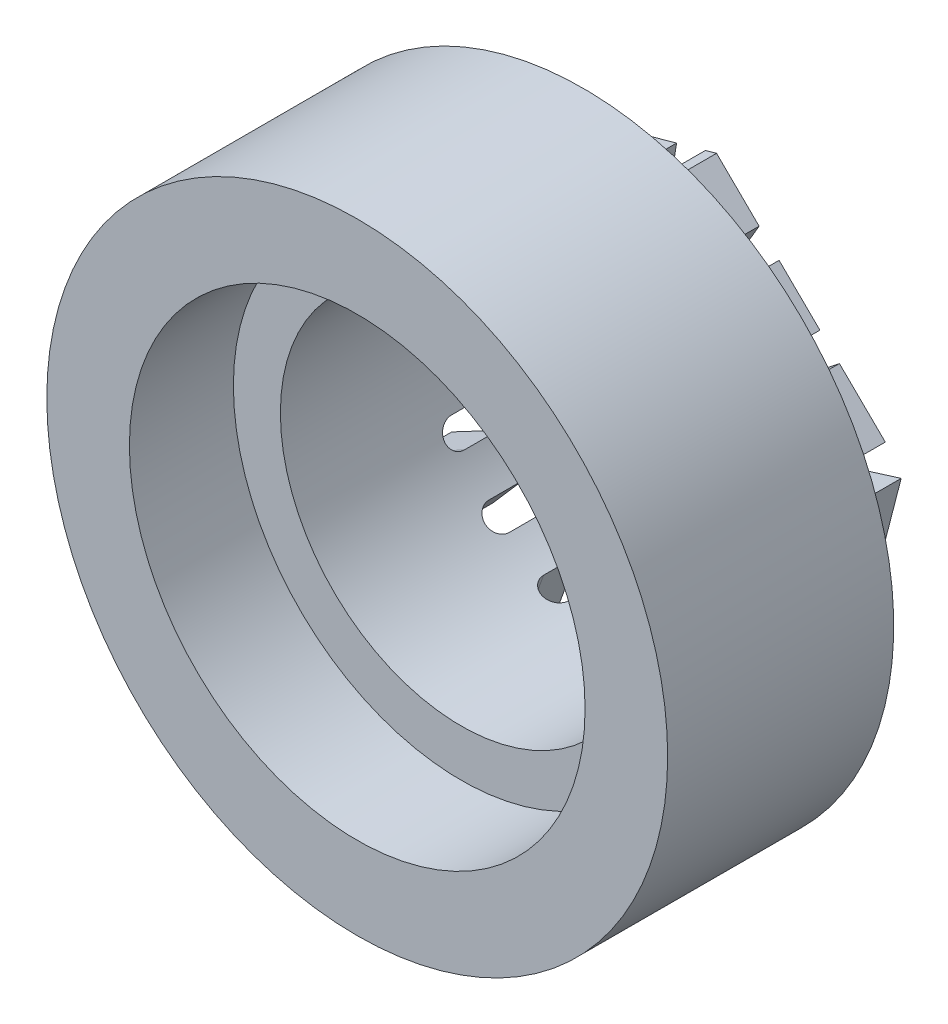
from build123d import *

# Parameters (mm, degrees)
SKETCH1_R           = 21.79955
BOSS_EXTRUDE1_DEPTH = 20.6502
SKETCH2_R           = 12.7
CUT_EXTRUDE1_DEPTH  = 20.6502
SKETCH3_R           = 16.000000004
CUT_EXTRUDE2_DEPTH  = 7.3025
SKETCH4_OUTSIDE_W   = 58.604
SKETCH4_OUTSIDE_H   = 58.604
CUT_EXTRUDE3_DEPTH  = 4.7752
CUT_EXTRUDE4_DEPTH  = 9.8552
CIRPATTERN1_COUNT   = 17


with BuildPart() as part:
    # Sketch1 → Boss-Extrude1 (new body)
    with BuildSketch(Plane.XY):
        Circle(SKETCH1_R)
    extrude(amount=BOSS_EXTRUDE1_DEPTH)

    # Sketch2 → Cut-Extrude1 (cut)
    with BuildSketch(Plane.XY.offset(20.6502)):
        Circle(SKETCH2_R)
    extrude(amount=-CUT_EXTRUDE1_DEPTH, mode=Mode.SUBTRACT)

    # Sketch3 → Cut-Extrude2 (cut)
    with BuildSketch(Plane.XY.offset(20.6502)):
        Circle(SKETCH3_R)
    extrude(amount=-CUT_EXTRUDE2_DEPTH, mode=Mode.SUBTRACT)

    # Sketch4 outside → Cut-Extrude3 (cut)
    with BuildSketch(Plane(origin=(0, 0, 0), x_dir=(-1, 0, 0), z_dir=(0, 0, -1))):
        Rectangle(SKETCH4_OUTSIDE_W, SKETCH4_OUTSIDE_H)
        Polygon((17.661795398, -4.907322758), (13.080763872, 12.841902112), (-4.581031526, 17.74922487), (-17.661795398, 4.907322758), (-13.080763872, -12.841902112), (4.581031526, -17.74922487), align=None, mode=Mode.SUBTRACT)
    extrude(amount=-CUT_EXTRUDE3_DEPTH, mode=Mode.SUBTRACT)

    # Sketch5 → Cut-Extrude4 (cut, symmetric)
    with BuildSketch(Plane(origin=(-15.371279635, 3.967289677, 0), x_dir=(0, 0, 1), z_dir=(-0.9682695833030739, 0.24990801117629627, 0))):
        with BuildLine():
            Line((2.3876, 0.9525), (0, 0.9525))
            Line((0, 0.9525), (0, -0.9525))
            Line((0, -0.9525), (2.3876, -0.9525))
            ThreePointArc((2.3876, -0.9525), (3.3401, 0), (2.3876, 0.9525))
        make_face()
    cut_extrude4 = extrude(amount=CUT_EXTRUDE4_DEPTH, both=True, mode=Mode.SUBTRACT)

    # CirPattern1: Cut-Extrude4 ×17 about axis
    cirpattern1_axis = Axis((0, 0, 13.3477), (0, 0, 1))
    for i in range(1, CIRPATTERN1_COUNT):
        add(cut_extrude4.rotate(cirpattern1_axis, i * 360 / CIRPATTERN1_COUNT), mode=Mode.SUBTRACT)


solid = part.part
